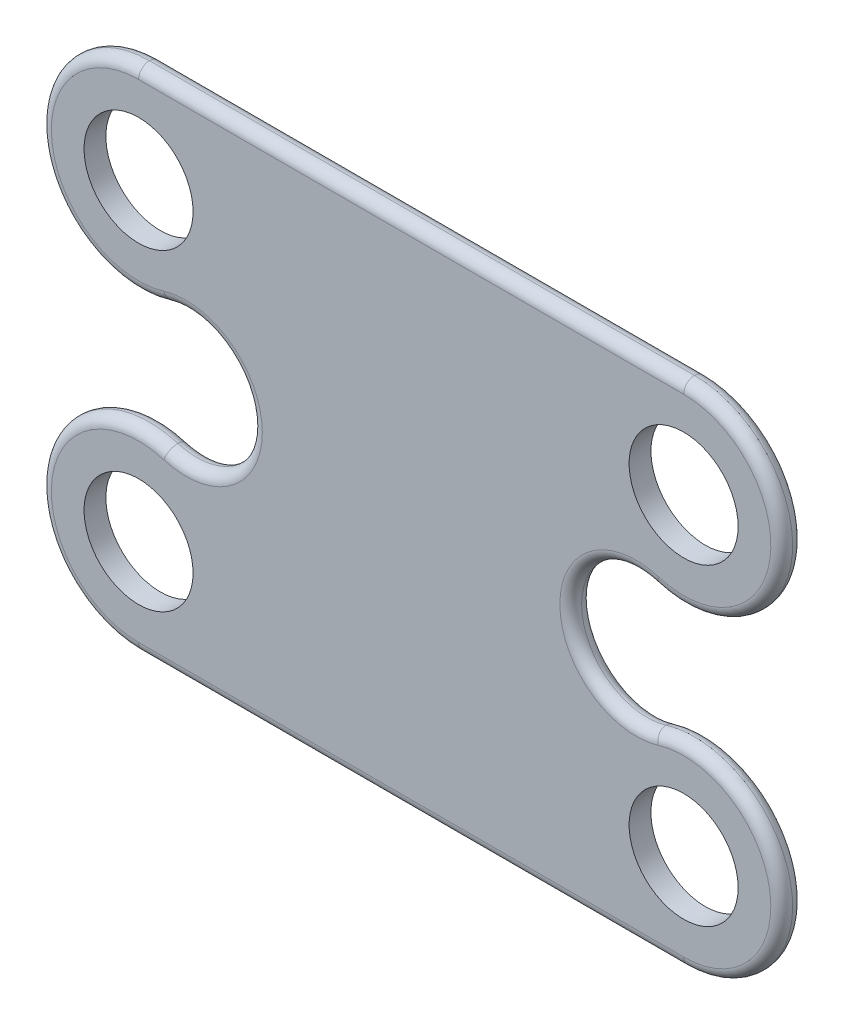
from build123d import *

# Parameters (mm, degrees)
SZKIC2_R                    = 5
DODANIE_WYCI_GNI_CIE1_DEPTH = 2
ZAOKR_GLENIE1_R             = 1


with BuildPart() as part:
    # Szkic2 → Dodanie-wyciągnięcie1 (new body)
    with BuildSketch(Plane.XY):
        with BuildLine():
            Line((25, 23.354152533), (-25, 23.354152533))
            ThreePointArc((-25, 23.354152533), (-33.902595792, 13.033626819), (-22.387531852, 5.741661013))
            ThreePointArc((-22.387531852, 5.741661013), (-14.64588642, 0), (-22.387531852, -5.741661013))
            ThreePointArc((-22.387531852, -5.741661013), (-33.902595792, -13.033626819), (-25, -23.354152533))
            Line((-25, -23.354152533), (25, -23.354152533))
            ThreePointArc((25, -23.354152533), (33.902595792, -13.033626819), (22.387531852, -5.741661013))
            ThreePointArc((22.387531852, -5.741661013), (14.64588642, 0), (22.387531852, 5.741661013))
            ThreePointArc((22.387531852, 5.741661013), (33.902595792, 13.033626819), (25, 23.354152533))
        make_face()
        with Locations((25, 14.354152533)):
            Circle(SZKIC2_R, mode=Mode.SUBTRACT)
        with Locations((-25, 14.354152533)):
            Circle(SZKIC2_R, mode=Mode.SUBTRACT)
        with Locations((25, -14.354152533)):
            Circle(SZKIC2_R, mode=Mode.SUBTRACT)
        with Locations((-25, -14.354152533)):
            Circle(SZKIC2_R, mode=Mode.SUBTRACT)
    extrude(amount=DODANIE_WYCI_GNI_CIE1_DEPTH)

    # Zaokrąglenie1
    zaokr_glenie1_edges = [part.edges().sort_by_distance(p)[0] for p in [
        (0, -23.354152533, 2),
        (0, -23.354152533, 0),
        (33.902595792, -13.033626819, 2),
        (33.902595792, -13.033626819, 0),
        (14.64588642, 0, 2),
        (14.64588642, 0, 0),
        (33.902595792, 13.033626819, 2),
        (33.902595792, 13.033626819, 0),
        (0, 23.354152533, 2),
        (0, 23.354152533, 0),
        (-33.902595792, 13.033626819, 2),
        (-33.902595792, 13.033626819, 0),
        (-33.902595792, -13.033626819, 2),
        (-33.902595792, -13.033626819, 0),
        (-14.64588642, 0, 2),
        (-14.64588642, 0, 0),
    ]]
    fillet(zaokr_glenie1_edges, radius=ZAOKR_GLENIE1_R - 0.0001)  # a hair under: the kernel refuses the full size


solid = part.part
